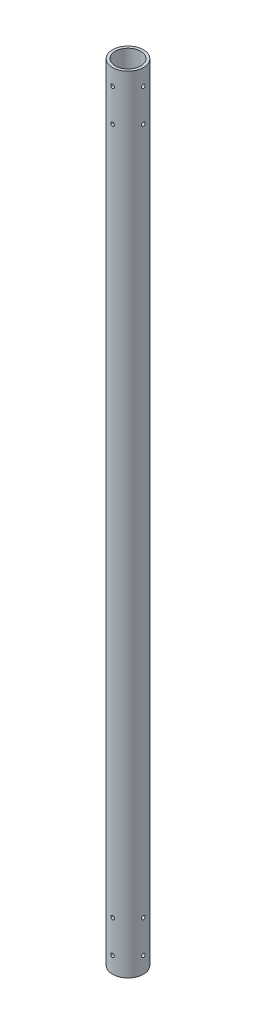
from build123d import *

# Parameters (mm, degrees)
SKETCH1_R           = 5.9944
SKETCH1_R_2         = 4.953
BOSS_EXTRUDE1_DEPTH = 304.8
CUT_EXTRUDE1_REACH  = 307.095
SKETCH2_R           = 0.6985
CIRPATTERN1_COUNT   = 4


with BuildPart() as part:
    # Sketch1 → Boss-Extrude1 (new body)
    with BuildSketch(Plane(origin=(0, 0, 0), x_dir=(1, 0, 0), z_dir=(0, 1, 0))):
        Circle(SKETCH1_R)
        Circle(SKETCH1_R_2, mode=Mode.SUBTRACT)
    extrude(amount=BOSS_EXTRUDE1_DEPTH)

    # Sketch2 → Cut-Extrude1 (cut, up to next)
    with BuildSketch(Plane.XY.offset(5.9944), mode=Mode.PRIVATE) as cut_extrude1_sk1:
        with Locations((0, 6.35)):
            Circle(SKETCH2_R)
    cut_extrude1_tool1 = extrude(cut_extrude1_sk1.sketch, amount=-CUT_EXTRUDE1_REACH, mode=Mode.PRIVATE) & part.part
    # Sketch2 → Cut-Extrude1 (cut, up to next)
    with BuildSketch(Plane.XY.offset(5.9944), mode=Mode.PRIVATE) as cut_extrude1_sk2:
        with Locations((0, 19.05)):
            Circle(SKETCH2_R)
    cut_extrude1_tool2 = extrude(cut_extrude1_sk2.sketch, amount=-CUT_EXTRUDE1_REACH, mode=Mode.PRIVATE) & part.part
    # Sketch2 → Cut-Extrude1 (cut, up to next)
    with BuildSketch(Plane.XY.offset(5.9944), mode=Mode.PRIVATE) as cut_extrude1_sk3:
        with Locations((0, 298.45)):
            Circle(SKETCH2_R)
    cut_extrude1_tool3 = extrude(cut_extrude1_sk3.sketch, amount=-CUT_EXTRUDE1_REACH, mode=Mode.PRIVATE) & part.part
    # Sketch2 → Cut-Extrude1 (cut, up to next)
    with BuildSketch(Plane.XY.offset(5.9944), mode=Mode.PRIVATE) as cut_extrude1_sk4:
        with Locations((0, 285.75)):
            Circle(SKETCH2_R)
    cut_extrude1_tool4 = extrude(cut_extrude1_sk4.sketch, amount=-CUT_EXTRUDE1_REACH, mode=Mode.PRIVATE) & part.part
    cut_extrude1_1 = cut_extrude1_tool1.solids().sort_by_distance((0, 6.35, 5.9944))[0]
    add(cut_extrude1_1, mode=Mode.SUBTRACT)
    cut_extrude1_2 = cut_extrude1_tool2.solids().sort_by_distance((0, 19.05, 5.9944))[0]
    add(cut_extrude1_2, mode=Mode.SUBTRACT)
    cut_extrude1_3 = cut_extrude1_tool3.solids().sort_by_distance((0, 298.45, 5.9944))[0]
    add(cut_extrude1_3, mode=Mode.SUBTRACT)
    cut_extrude1_4 = cut_extrude1_tool4.solids().sort_by_distance((0, 285.75, 5.9944))[0]
    add(cut_extrude1_4, mode=Mode.SUBTRACT)
    cut_extrude1 = cut_extrude1_1 + cut_extrude1_2 + cut_extrude1_3 + cut_extrude1_4  # Cut-Extrude1 as one shape, for the pattern or mirror that repeats it

    # CirPattern1: Cut-Extrude1 ×4 about axis
    cirpattern1_axis = Axis((0, 304.8, 0), (0, 1, 0))
    for i in range(1, CIRPATTERN1_COUNT):
        add(cut_extrude1.rotate(cirpattern1_axis, i * 360 / CIRPATTERN1_COUNT), mode=Mode.SUBTRACT)


solid = part.part
